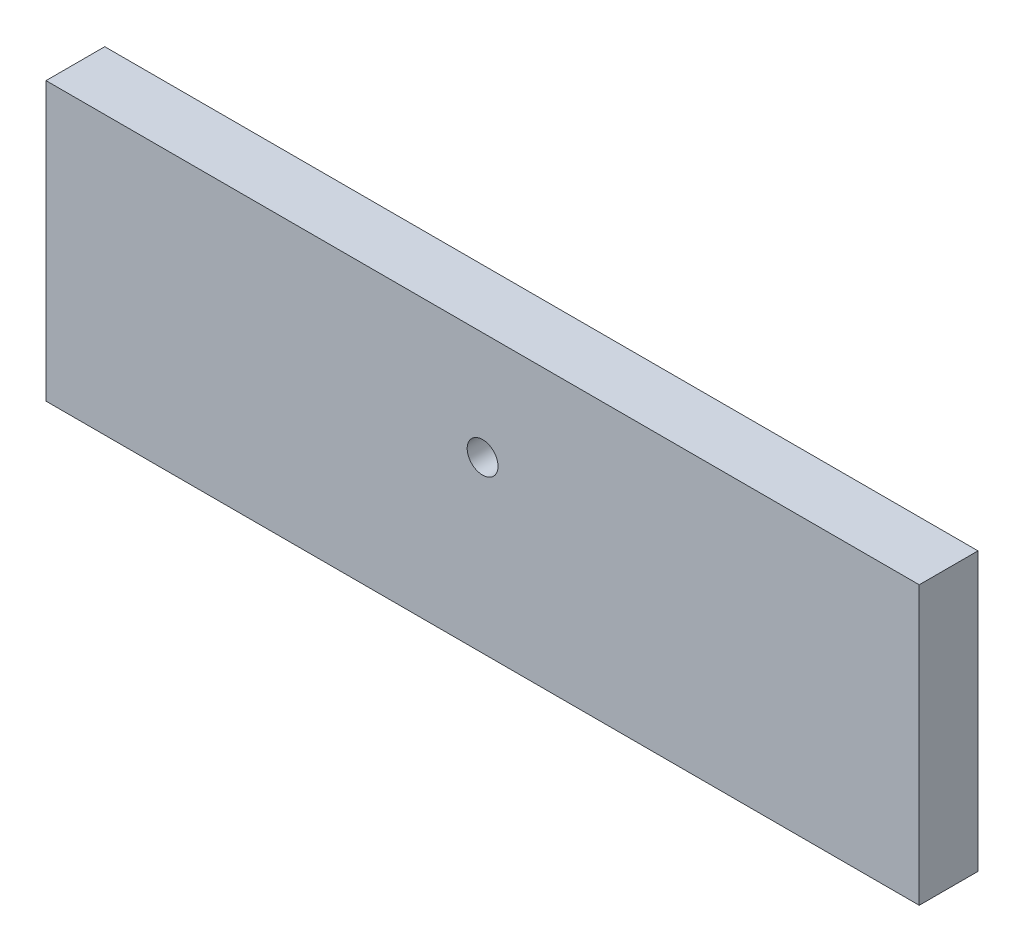
from build123d import *

# Parameters (mm, degrees)
SKETCH1_W           = 283.1
SKETCH1_H           = 90
BOSS_EXTRUDE1_DEPTH = 19.05
SKETCH2_R           = 5
CUT_EXTRUDE1_DEPTH  = 169.817371736


with BuildPart() as part:
    # Sketch1 → Boss-Extrude1 (new body)
    with BuildSketch(Plane.XY):
        with Locations((0, 45)):
            Rectangle(SKETCH1_W, SKETCH1_H)
    extrude(amount=BOSS_EXTRUDE1_DEPTH)

    # Sketch2 → Cut-Extrude1 (cut, through all)
    with BuildSketch(Plane.XY.offset(19.05)):
        with Locations((0, 55)):
            Circle(SKETCH2_R)
    extrude(amount=-CUT_EXTRUDE1_DEPTH, mode=Mode.SUBTRACT)


solid = part.part
